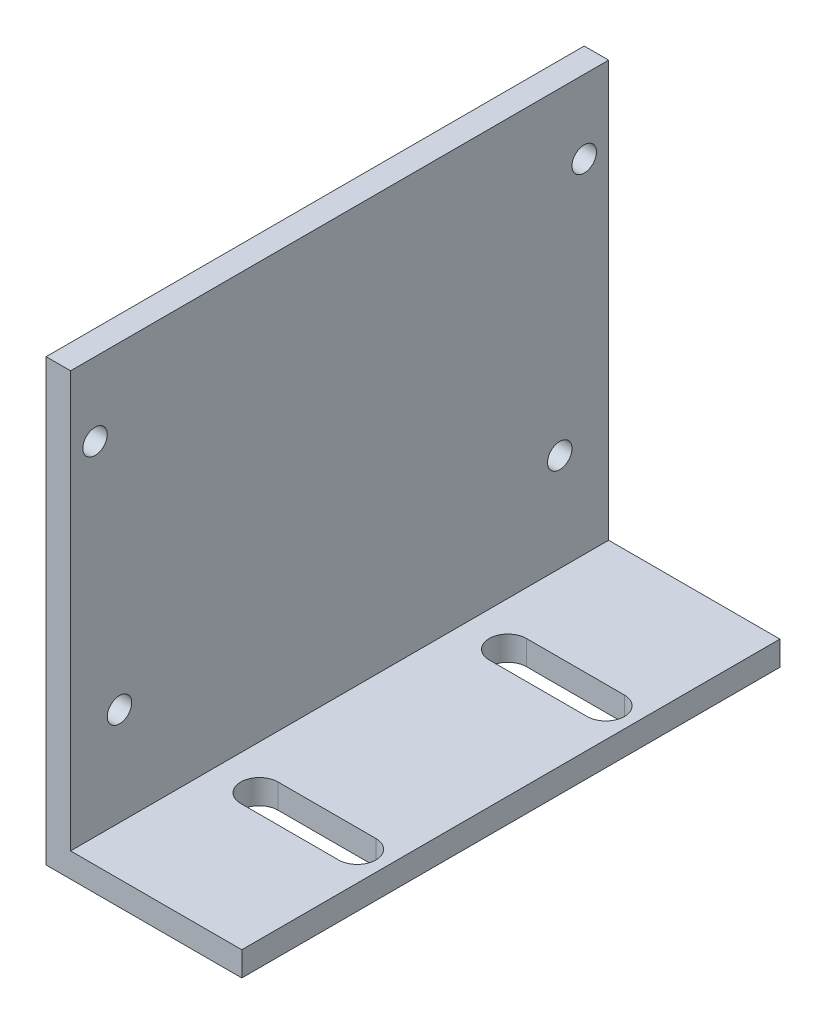
from build123d import *

# Parameters (mm, degrees)
BOSS_EXTRUDE1_DEPTH = 27.5
CUT_EXTRUDE1_REACH  = 57.565
SKETCH2_R           = 1.25
CUT_EXTRUDE2_REACH  = 56.429


with BuildPart() as part:
    # Sketch1 → Boss-Extrude1 (new, symmetric)
    with BuildSketch(Plane.XY):
        Polygon((0, 0), (-20, 0), (-20, 45), (-17.5, 45), (-17.5, 2.5), (0, 2.5), align=None)
    extrude(amount=BOSS_EXTRUDE1_DEPTH, both=True)

    # Sketch2 → Cut-Extrude1 (cut, up to next)
    with BuildSketch(Plane(origin=(-17.5, 0, 0), x_dir=(0, 0, -1), z_dir=(1, 0, 0)), mode=Mode.PRIVATE) as cut_extrude1_sk1:
        with Locations((-25, 37.5)):
            Circle(SKETCH2_R)
    cut_extrude1_tool1 = extrude(cut_extrude1_sk1.sketch, amount=-CUT_EXTRUDE1_REACH, mode=Mode.PRIVATE) & part.part
    # Sketch2 → Cut-Extrude1 (cut, up to next)
    with BuildSketch(Plane(origin=(-17.5, 0, 0), x_dir=(0, 0, -1), z_dir=(1, 0, 0)), mode=Mode.PRIVATE) as cut_extrude1_sk2:
        with Locations((25, 37.5)):
            Circle(SKETCH2_R)
    cut_extrude1_tool2 = extrude(cut_extrude1_sk2.sketch, amount=-CUT_EXTRUDE1_REACH, mode=Mode.PRIVATE) & part.part
    # Sketch2 → Cut-Extrude1 (cut, up to next)
    with BuildSketch(Plane(origin=(-17.5, 0, 0), x_dir=(0, 0, -1), z_dir=(1, 0, 0)), mode=Mode.PRIVATE) as cut_extrude1_sk3:
        with Locations((-22.5, 12.5)):
            Circle(SKETCH2_R)
    cut_extrude1_tool3 = extrude(cut_extrude1_sk3.sketch, amount=-CUT_EXTRUDE1_REACH, mode=Mode.PRIVATE) & part.part
    # Sketch2 → Cut-Extrude1 (cut, up to next)
    with BuildSketch(Plane(origin=(-17.5, 0, 0), x_dir=(0, 0, -1), z_dir=(1, 0, 0)), mode=Mode.PRIVATE) as cut_extrude1_sk4:
        with Locations((22.5, 12.5)):
            Circle(SKETCH2_R)
    cut_extrude1_tool4 = extrude(cut_extrude1_sk4.sketch, amount=-CUT_EXTRUDE1_REACH, mode=Mode.PRIVATE) & part.part
    add(cut_extrude1_tool1.solids().sort_by_distance((-17.5, 37.5, 25))[0], mode=Mode.SUBTRACT)
    add(cut_extrude1_tool2.solids().sort_by_distance((-17.5, 37.5, -25))[0], mode=Mode.SUBTRACT)
    add(cut_extrude1_tool3.solids().sort_by_distance((-17.5, 12.5, 22.5))[0], mode=Mode.SUBTRACT)
    add(cut_extrude1_tool4.solids().sort_by_distance((-17.5, 12.5, -22.5))[0], mode=Mode.SUBTRACT)

    # Sketch3 → Cut-Extrude2 (cut, up to next)
    with BuildSketch(Plane(origin=(0, 2.5, 0), x_dir=(1, 0, 0), z_dir=(0, 1, 0)), mode=Mode.PRIVATE) as cut_extrude2_sk1:
        with BuildLine():
            Line((-13, -10.795), (-3, -10.795))
            ThreePointArc((-3, -10.795), (-1.095, -12.7), (-3, -14.605))
            Line((-3, -14.605), (-13, -14.605))
            ThreePointArc((-13, -14.605), (-14.905, -12.7), (-13, -10.795))
        make_face()
    cut_extrude2_tool1 = extrude(cut_extrude2_sk1.sketch, amount=-CUT_EXTRUDE2_REACH, mode=Mode.PRIVATE) & part.part
    # Sketch3 → Cut-Extrude2 (cut, up to next)
    with BuildSketch(Plane(origin=(0, 2.5, 0), x_dir=(1, 0, 0), z_dir=(0, 1, 0)), mode=Mode.PRIVATE) as cut_extrude2_sk2:
        with BuildLine():
            Line((-13, 10.795), (-3, 10.795))
            ThreePointArc((-3, 10.795), (-1.095, 12.7), (-3, 14.605))
            Line((-3, 14.605), (-13, 14.605))
            ThreePointArc((-13, 14.605), (-14.905, 12.7), (-13, 10.795))
        make_face()
    cut_extrude2_tool2 = extrude(cut_extrude2_sk2.sketch, amount=-CUT_EXTRUDE2_REACH, mode=Mode.PRIVATE) & part.part
    add(cut_extrude2_tool1.solids().sort_by_distance((-8, 2.5, 12.7))[0], mode=Mode.SUBTRACT)
    add(cut_extrude2_tool2.solids().sort_by_distance((-8, 2.5, -12.7))[0], mode=Mode.SUBTRACT)


solid = part.part
